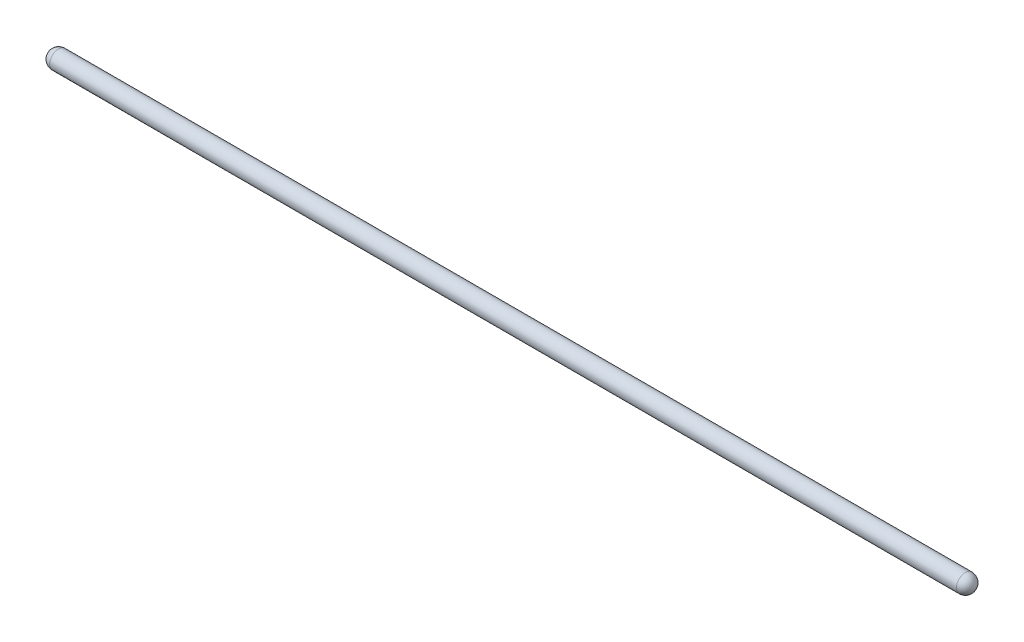
from build123d import *

# Parameters (mm, degrees)
REVOLVE1_ANGLE = 359.999695921


with BuildPart() as part:
    # Sketch1 → Revolve1 (revolve)
    with BuildSketch(Plane.XY):
        with BuildLine():
            Line((3, 3), (307, 3))
            ThreePointArc((307, 3), (309.121320344, 2.121320344), (310, 0))
            Line((310, 0), (0, 0))
            ThreePointArc((0, 0), (0.878679656, 2.121320344), (3, 3))
        make_face()
    revolve(axis=Axis((0, 0, 0), (1, 0, 0)), revolution_arc=REVOLVE1_ANGLE)


solid = part.part
